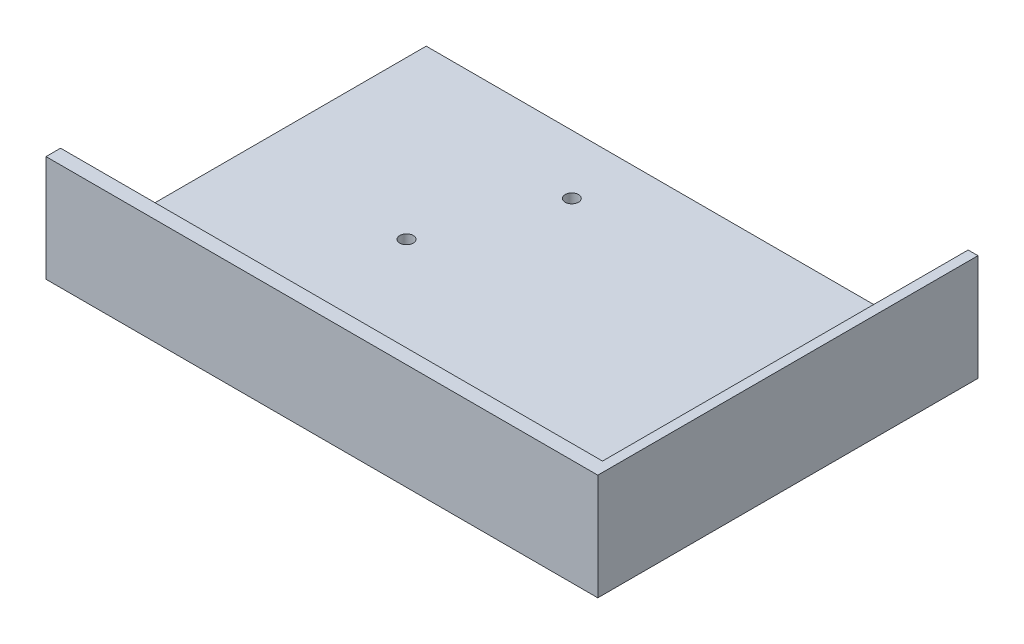
from build123d import *

# Parameters (mm, degrees)
SKETCH1_W                     = 280.4
SKETCH1_H                     = 193.2
SHELL_BLOCK_DEPTH             = 27
SKETCH2_W                     = 275.4
SKETCH2_H                     = 185.8
FRONT_OPENING_DEPTH           = 1.5
SKETCH3_W                     = 275.4
SKETCH3_H                     = 188.2
DISPLAY_POCKET_DEPTH          = 22.5
SKETCH4_W                     = 3
SKETCH4_H                     = 56
VENT_SLOTS_DEPTH              = 4
SKETCH5_W                     = 70
SKETCH5_H                     = 16
CABLE_EXIT_X_SHORT_SIDE_DEPTH = 141.2
SKETCH6_R                     = 1.7
BOLT_HOLES_DEPTH              = 4
KEEP_ONE_HALF_X_DEPTH         = 173.385034153
KEEP_ONE_HALF_X_DEPTH_BACK    = 173.385034153
SKETCH7_W                     = 200
SKETCH7_H                     = 400
KEEP_ONE_QUARTER_Z_DEPTH      = 173.385034153
KEEP_ONE_QUARTER_Z_DEPTH_BACK = 173.385034153
SKETCH8_W                     = 400
SKETCH8_H                     = 200


with BuildPart() as part:
    # Sketch1 → Shell Block (new body)
    with BuildSketch(Plane(origin=(0, 0, 0), x_dir=(1, 0, 0), z_dir=(0, 1, 0))):
        Rectangle(SKETCH1_W, SKETCH1_H)
    extrude(amount=SHELL_BLOCK_DEPTH)

    # Sketch2 → Front Opening (cut)
    with BuildSketch(Plane(origin=(0, 27, 0), x_dir=(1, 0, 0), z_dir=(0, 1, 0))):
        Rectangle(SKETCH2_W, SKETCH2_H)
    extrude(amount=-FRONT_OPENING_DEPTH, mode=Mode.SUBTRACT)

    # Sketch3 → Display Pocket (cut)
    with BuildSketch(Plane(origin=(0, 25.5, 0), x_dir=(1, 0, 0), z_dir=(0, 1, 0))):
        Rectangle(SKETCH3_W, SKETCH3_H)
    extrude(amount=-DISPLAY_POCKET_DEPTH, mode=Mode.SUBTRACT)

    # Sketch4 → Vent Slots (cut)
    with BuildSketch(Plane(origin=(0, 3, 0), x_dir=(1, 0, 0), z_dir=(0, 1, 0))):
        with Locations((-67.5, 56)):
            Rectangle(SKETCH4_W, SKETCH4_H)
        with Locations((-67.5, -56)):
            Rectangle(SKETCH4_W, SKETCH4_H)
        with Locations((-75.5, 56)):
            Rectangle(SKETCH4_W, SKETCH4_H)
        with Locations((-75.5, -56)):
            Rectangle(SKETCH4_W, SKETCH4_H)
        with Locations((-83.5, 56)):
            Rectangle(SKETCH4_W, SKETCH4_H)
        with Locations((-83.5, -56)):
            Rectangle(SKETCH4_W, SKETCH4_H)
        with Locations((-91.5, 56)):
            Rectangle(SKETCH4_W, SKETCH4_H)
        with Locations((-91.5, -56)):
            Rectangle(SKETCH4_W, SKETCH4_H)
        with Locations((-99.5, 56)):
            Rectangle(SKETCH4_W, SKETCH4_H)
        with Locations((-99.5, -56)):
            Rectangle(SKETCH4_W, SKETCH4_H)
        with Locations((-107.5, 56)):
            Rectangle(SKETCH4_W, SKETCH4_H)
        with Locations((-107.5, -56)):
            Rectangle(SKETCH4_W, SKETCH4_H)
        with Locations((-115.5, 56)):
            Rectangle(SKETCH4_W, SKETCH4_H)
        with Locations((-115.5, -56)):
            Rectangle(SKETCH4_W, SKETCH4_H)
        with Locations((-123.5, 56)):
            Rectangle(SKETCH4_W, SKETCH4_H)
        with Locations((-123.5, -56)):
            Rectangle(SKETCH4_W, SKETCH4_H)
    extrude(amount=-VENT_SLOTS_DEPTH, mode=Mode.SUBTRACT)

    # Sketch5 → Cable Exit (-X short side) (cut)
    with BuildSketch(Plane(origin=(0, 0, 0), x_dir=(0, 0, -1), z_dir=(1, 0, 0))):
        with Locations((0, 13)):
            Rectangle(SKETCH5_W, SKETCH5_H)
    extrude(amount=-CABLE_EXIT_X_SHORT_SIDE_DEPTH, mode=Mode.SUBTRACT)

    # Sketch6 → Bolt Holes (cut)
    with BuildSketch(Plane(origin=(0, 3, 0), x_dir=(1, 0, 0), z_dir=(0, 1, 0))):
        with Locations((-40, -45)):
            Circle(SKETCH6_R)
        with Locations((-40, 45)):
            Circle(SKETCH6_R)
        with Locations((40, -45)):
            Circle(SKETCH6_R)
        with Locations((40, 45)):
            Circle(SKETCH6_R)
        with Locations((-52, -15)):
            Circle(SKETCH6_R)
        with Locations((-52, 15)):
            Circle(SKETCH6_R)
        with Locations((52, -15)):
            Circle(SKETCH6_R)
        with Locations((52, 15)):
            Circle(SKETCH6_R)
        with Locations((-12, -82)):
            Circle(SKETCH6_R)
        with Locations((-12, 82)):
            Circle(SKETCH6_R)
        with Locations((12, -82)):
            Circle(SKETCH6_R)
        with Locations((12, 82)):
            Circle(SKETCH6_R)
        with Locations((-124, -12)):
            Circle(SKETCH6_R)
        with Locations((-124, 12)):
            Circle(SKETCH6_R)
        with Locations((124, -12)):
            Circle(SKETCH6_R)
        with Locations((124, 12)):
            Circle(SKETCH6_R)
    extrude(amount=-BOLT_HOLES_DEPTH, mode=Mode.SUBTRACT)

    # Sketch7 → Keep one half (X) (cut, two sides: drawn at the far end of the back side and taken through both)
    with BuildSketch(Plane(origin=(0, 0, 0), x_dir=(1, 0, 0), z_dir=(0, 1, 0)).offset(-KEEP_ONE_HALF_X_DEPTH_BACK)):
        with Locations((-100, 0)):
            Rectangle(SKETCH7_W, SKETCH7_H)
    extrude(amount=KEEP_ONE_HALF_X_DEPTH + KEEP_ONE_HALF_X_DEPTH_BACK, mode=Mode.SUBTRACT)

    # Sketch8 → Keep one quarter (Z) (cut, two sides: drawn at the far end of the back side and taken through both)
    with BuildSketch(Plane(origin=(0, 0, 0), x_dir=(1, 0, 0), z_dir=(0, 1, 0)).offset(-KEEP_ONE_QUARTER_Z_DEPTH_BACK)):
        with Locations((0, 100)):
            Rectangle(SKETCH8_W, SKETCH8_H)
    extrude(amount=KEEP_ONE_QUARTER_Z_DEPTH + KEEP_ONE_QUARTER_Z_DEPTH_BACK, mode=Mode.SUBTRACT)


solid = part.part
